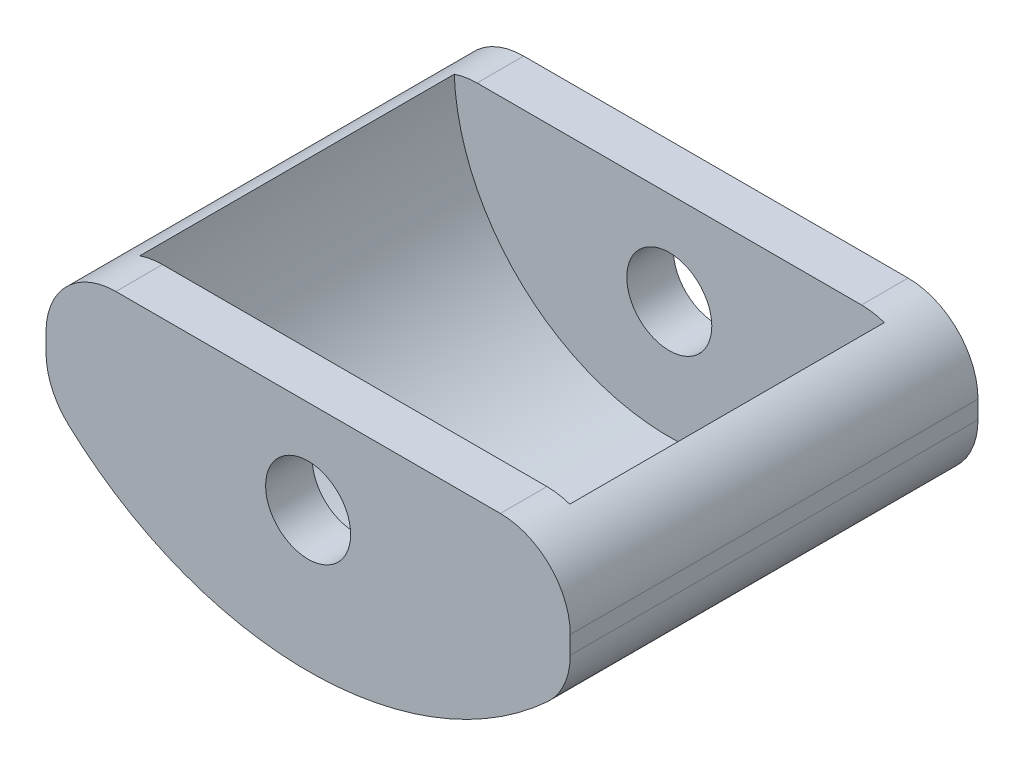
from build123d import *

# Parameters (mm, degrees)
SKETCH1_W               = 22.5
SKETCH1_H               = 17.5
BOSS_EXTRUDE1_DEPTH     = 10
CUT_EXTRUDE1_DEPTH      = 24.082731641
CUT_EXTRUDE1_DEPTH_BACK = 24.082731641
SKETCH2_R               = 1.825
CUT_EXTRUDE2_DEPTH      = 13.5
CUT_EXTRUDE3_REACH      = 19.405
SKETCH4_W               = 11.529065942
SKETCH4_H               = 13.5
FILLET1_R               = 3


with BuildPart() as part:
    # Sketch1 → Boss-Extrude1 (new body)
    with BuildSketch(Plane(origin=(0, 0, 0), x_dir=(1, 0, 0), z_dir=(0, 1, 0))):
        Rectangle(SKETCH1_W, SKETCH1_H)
    extrude(amount=BOSS_EXTRUDE1_DEPTH)

    # Sketch2 → Cut-Extrude1 (cut, two sides: drawn at the far end of the back side and taken through both)
    with BuildSketch(Plane.XY.offset(8.75).offset(-CUT_EXTRUDE1_DEPTH_BACK)):
        with Locations((0, 6)):
            Circle(SKETCH2_R)
        with BuildLine():
            Line((-11.25, 5), (-11.25, 0))
            Line((-11.25, 0), (11.25, 0))
            Line((11.25, 0), (11.25, 5))
            ThreePointArc((11.25, 5), (0, 0.01), (-11.25, 5))
        make_face()
    extrude(amount=CUT_EXTRUDE1_DEPTH + CUT_EXTRUDE1_DEPTH_BACK, mode=Mode.SUBTRACT)

    # Sketch3 → Cut-Extrude2 (cut)
    with BuildSketch(Plane.XY.offset(6.75)):
        with BuildLine():
            ThreePointArc((-9.233945582, 9.952114837), (0, 0.969656164), (9.233945582, 9.952114837))
            ThreePointArc((9.233945582, 9.952114837), (7.547885163, 11.733945582), (5.766054418, 10.047885163))
            ThreePointArc((5.766054418, 10.047885163), (0, 4.438869486), (-5.766054418, 10.047885163))
            ThreePointArc((-5.766054418, 10.047885163), (-7.547885163, 11.733945582), (-9.233945582, 9.952114837))
        make_face()
    extrude(amount=-CUT_EXTRUDE2_DEPTH, mode=Mode.SUBTRACT)

    # Sketch4 → Cut-Extrude3 (cut, up to next)
    with BuildSketch(Plane(origin=(0, 10, 0), x_dir=(1, 0, 0), z_dir=(0, 1, 0)), mode=Mode.PRIVATE) as cut_extrude3_sk1:
        Rectangle(SKETCH4_W, SKETCH4_H)
    cut_extrude3_tool1 = extrude(cut_extrude3_sk1.sketch, amount=-CUT_EXTRUDE3_REACH, mode=Mode.PRIVATE) & part.part
    add(cut_extrude3_tool1.solids().sort_by_distance((0, 10, 0))[0], mode=Mode.SUBTRACT)

    # Fillet1
    # the kernel refuses this fillet: 3 mm, written as the material it takes off along each edge
    with BuildSketch(Plane(origin=(11.25, 5, 12.185069568), x_dir=(0, 1, 0), z_dir=(0, 0, -1))) as fillet1_piece_1:
        with BuildLine():
            CenterArc((1.230754269, -3), FILLET1_R, 90, 47.349204062)
            ThreePointArc((-0.975735859, -0.967415115), (-0.498821765, -0.472659508), (0, 0))
            Line((0, 0), (1.230754269, 0))
        make_face()
    extrude(amount=24.370139136, mode=Mode.SUBTRACT)
    with BuildSketch(Plane(origin=(-11.25, 5, 12.185069568), x_dir=(0, 1, 0), z_dir=(0, 0, -1))) as fillet1_piece_2:
        with BuildLine():
            CenterArc((1.230754269, 3), FILLET1_R, 222.650795938, 47.349204062)
            ThreePointArc((-0.975735859, 0.967415115), (-0.498821765, 0.472659508), (0, 0))
            Line((0, 0), (1.230754269, 0))
        make_face()
    extrude(amount=24.370139136, mode=Mode.SUBTRACT)
    with BuildSketch(Plane(origin=(11.25, 10, -16.25), x_dir=(-1, 0, 0), z_dir=(0, 0, 1))) as fillet1_piece_3:
        with BuildLine():
            CenterArc((FILLET1_R, FILLET1_R), FILLET1_R, 180, 90)
            Line((0, FILLET1_R), (0, 0))
            Line((0, 0), (FILLET1_R, 0))
        make_face()
    extrude(amount=32.5, mode=Mode.SUBTRACT)
    with BuildSketch(Plane(origin=(-11.25, 10, 16.25), x_dir=(0, -1, 0), z_dir=(0, 0, -1))) as fillet1_piece_4:
        with BuildLine():
            CenterArc((FILLET1_R, -FILLET1_R), FILLET1_R, 90, 90)
            Line((0, -FILLET1_R), (0, 0))
            Line((0, 0), (FILLET1_R, 0))
        make_face()
    extrude(amount=32.5, mode=Mode.SUBTRACT)


solid = part.part
